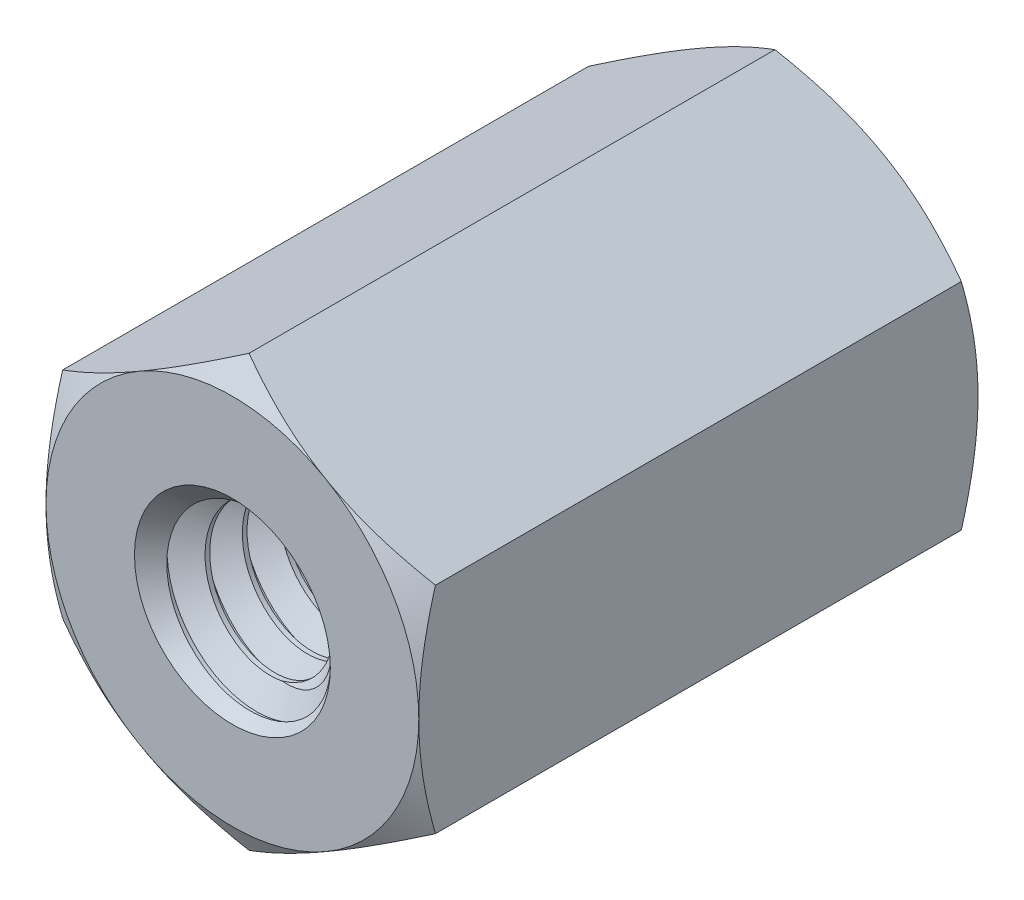
from build123d import *

# Parameters (mm, degrees)
EXTRUDE1_DEPTH          = 3
EXTRUDE1_DEPTH_BACK     = 3
SKETCH19_R              = 1
SKETCH8_OUTSIDE_W       = 34.5
SKETCH8_OUTSIDE_H       = 35.118
SKETCH8_OUTSIDE_R       = 2
EXTRUDE4_DEPTH          = 7.733003292
EXTRUDE4_DRAFT          = -60
MIRROR2_COPY_1_SKETCH_W = 34.5
MIRROR2_COPY_1_SKETCH_H = 35.118
MIRROR2_COPY_1_SKETCH_R = 2
MIRROR2_COPY_1_DEPTH    = 7.733003292
MIRROR2_COPY_1_DRAFT    = -60
SWEEP1_PITCH            = 0.4
EXTRUDE2_DEPTH          = 8.091935707


with BuildPart() as part:
    # Sketch19 → Extrude1 (new, two sides: drawn at the far end of the back side and taken through both)
    with BuildSketch(Plane.XY.offset(-EXTRUDE1_DEPTH_BACK)):
        Polygon((0, 2.309401077), (-2, 1.154700538), (-2, -1.154700538), (0, -2.309401077), (2, -1.154700538), (2, 1.154700538), align=None)
        Circle(SKETCH19_R, mode=Mode.SUBTRACT)
    extrude(amount=EXTRUDE1_DEPTH + EXTRUDE1_DEPTH_BACK)


with BuildPart() as extrude4_tool:
    # Sketch8 outside → Extrude4 (with draft: the straight prism first)
    with BuildSketch(Plane(origin=(0, 0, -3), x_dir=(-1, 0, 0), z_dir=(0, 0, -1))):
        Rectangle(SKETCH8_OUTSIDE_W, SKETCH8_OUTSIDE_H)
        Circle(SKETCH8_OUTSIDE_R, mode=Mode.SUBTRACT)
    extrude(amount=-EXTRUDE4_DEPTH)
    # Extrude4: the draft: its side faces are tilted about the plane it starts from
    extrude4_sides = [extrude4_tool.faces().sort_by_distance(p)[0] for p in [
        (0, -17.559, 0.866501646),
        (-17.25, 0, 0.866501646),
        (0, 17.559, 0.866501646),
        (17.25, 0, 0.866501646),
        (2, 0, 0.866501646),
    ]]
    draft(extrude4_sides, Plane(origin=(0, 0, -3), x_dir=(-1, 0, 0), z_dir=(0, 0, -1)), EXTRUDE4_DRAFT)


with BuildPart() as part_1:
    add(part.part)

    # Extrude4: cut by extrude4_tool
    add(extrude4_tool.part, mode=Mode.SUBTRACT)


with BuildPart() as mirror2_copy_1_tool:
    # Mirror2 copy 1 sketch → Mirror2 copy 1 (with draft: the straight prism first)
    with BuildSketch(Plane(origin=(0, 0, 3), x_dir=(-1, 0, 0), z_dir=(0, 0, 1))):
        Rectangle(MIRROR2_COPY_1_SKETCH_W, MIRROR2_COPY_1_SKETCH_H)
        Circle(MIRROR2_COPY_1_SKETCH_R, mode=Mode.SUBTRACT)
    extrude(amount=-MIRROR2_COPY_1_DEPTH)
    # Mirror2 copy 1: the draft: its side faces are tilted about the plane it starts from
    mirror2_copy_1_sides = [mirror2_copy_1_tool.faces().sort_by_distance(p)[0] for p in [
        (0, -17.559, -0.866501646),
        (-17.25, 0, -0.866501646),
        (0, 17.559, -0.866501646),
        (17.25, 0, -0.866501646),
        (2, 0, -0.866501646),
    ]]
    draft(mirror2_copy_1_sides, Plane(origin=(0, 0, 3), x_dir=(-1, 0, 0), z_dir=(0, 0, 1)), MIRROR2_COPY_1_DRAFT)


with BuildPart() as part_2:
    add(part_1.part)

    # Mirror2 copy 1: cut by mirror2_copy_1_tool
    add(mirror2_copy_1_tool.part, mode=Mode.SUBTRACT)

    # Sweep1: the profile of Sketch12 profile screwed along a right-hand helix of 16 turns, 6 arcs to a turn; built about Z, then put on its axis
    sweep1_z = Axis((0, 0, 0), (0, 0, 1))
    sweep1_corners = [(1.0003, 0, -0.350173205), (1.0003, 0, 0.000173205), (0.740192379, 0, -0.15), (0.740192379, 0, -0.2)]
    with BuildLine(mode=Mode.PRIVATE) as sweep1_profile:
        Line(sweep1_corners[0], sweep1_corners[1])
        Line(sweep1_corners[1], sweep1_corners[2])
        Line(sweep1_corners[2], sweep1_corners[3])
        Line(sweep1_corners[3], sweep1_corners[0])
    sweep1_cap = Face(sweep1_profile.wire())
    sweep1_turn_angles = [0, 30, 60, 90, 120, 150, 180, 210, 240, 270, 300, 330, 360]
    sweep1_turn_weights = [1, 0.8660254037844387, 1, 0.8660254037844387, 1, 0.8660254037844387, 1, 0.8660254037844387, 1, 0.8660254037844387, 1, 0.8660254037844387, 1]
    sweep1_turn_rails = [Edge.make_bspline([Vector(p[0], p[1], 0).rotate(sweep1_z, sweep1_turn_angles[k]) / sweep1_turn_weights[k] + Vector(0, 0, p[2] + SWEEP1_PITCH * sweep1_turn_angles[k] / 360) for k in range(13)], [0, 0, 0, 1, 1, 2, 2, 3, 3, 4, 4, 5, 5, 6, 6, 6], 2, sweep1_turn_weights) for p in sweep1_corners]
    sweep1_turn_sides = [Face.make_surface_from_curves(sweep1_turn_rails[p[0]], sweep1_turn_rails[p[1]]) for p in [(0, 1), (1, 2), (2, 3), (3, 0)]]
    sweep1 = Plane(origin=(0, 0, -3), x_dir=(0, 1, 0), z_dir=(0, 0, 1)) * Solid(Shell([*[p.moved(Location((0, 0, SWEEP1_PITCH * i))) for i in range(16) for p in sweep1_turn_sides], sweep1_cap, sweep1_cap.rotate(sweep1_z, 5760).moved(Location((0, 0, SWEEP1_PITCH * 5760 / 360)))]))
    add(sweep1)

    # Sketch6 → Extrude2 (cut, through all)
    with BuildSketch(Plane(origin=(0, 0, -3), x_dir=(-1, 0, 0), z_dir=(0, 0, -1))):
        with BuildLine():
            ThreePointArc((-1, 1.732050808), (-1.732050808, 1), (-2, 0))
            ThreePointArc((-2, 0), (-1.732050808, -1), (-1, -1.732050808))
            ThreePointArc((-1, -1.732050808), (0, -2), (1, -1.732050808))
            ThreePointArc((1, -1.732050808), (1.732050808, -1), (2, 0))
            ThreePointArc((2, 0), (1.732050808, 1), (1, 1.732050808))
            ThreePointArc((1, 1.732050808), (0, 2), (-1, 1.732050808))
        make_face()
    extrude2 = extrude(amount=EXTRUDE2_DEPTH, mode=Mode.SUBTRACT)

    # Extrude3 cone 1 section (through the dimple's axis) → Extrude3 (revolve, cut)
    with BuildSketch(Plane(origin=(0, 0, -3), x_dir=(0, 1, 0), z_dir=(1, 0, 0))):
        Polygon((0, 0), (1.0508, 0), (0, 1.12684504), align=None)
    extrude3 = revolve(axis=Axis((0, 0, -3), (0, 0, 1)), mode=Mode.SUBTRACT)

    # Mirror1: Extrude2, Extrude3 across plane
    add(extrude2.mirror(Plane.XY), mode=Mode.SUBTRACT)
    add(extrude3.mirror(Plane.XY), mode=Mode.SUBTRACT)


solid = part_2.part
